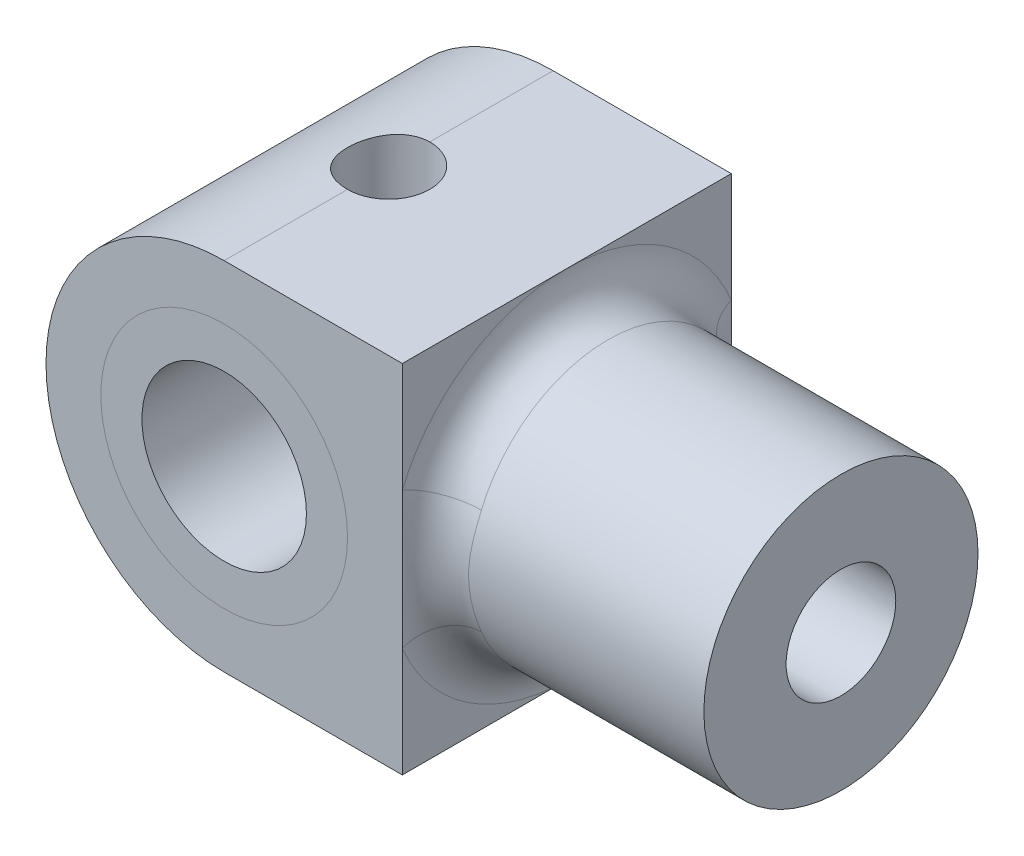
from build123d import *

# Parameters (mm, degrees)
SKETCH1_R           = 4.5
BOSS_EXTRUDE1_DEPTH = 6
SKETCH2_R           = 5
SKETCH2_R_2         = 2
BOSS_EXTRUDE2_DEPTH = 10
FILLET1_R           = 1.5
SKETCH1_3_R         = 4.5
SKETCH1_3_R_2       = 3
BOSS_EXTRUDE3_DEPTH = 6
SKETCH3_R           = 1.5
CUT_EXTRUDE1_DEPTH  = 19.721645382


with BuildPart() as part:
    # Sketch1 → Boss-Extrude1 (new, symmetric)
    with BuildSketch(Plane.XY):
        with BuildLine():
            ThreePointArc((0, -6.5), (-6.5, 0), (0, 6.5))
            Line((0, 6.5), (6.5, 6.5))
            Line((6.5, 6.5), (6.5, -6.5))
            Line((6.5, -6.5), (0, -6.5))
        make_face()
        Circle(SKETCH1_R, mode=Mode.SUBTRACT)
    extrude(amount=BOSS_EXTRUDE1_DEPTH, both=True)

    # Sketch2 → Boss-Extrude2 (add)
    with BuildSketch(Plane(origin=(6.5, 0, 0), x_dir=(0, 0, -1), z_dir=(1, 0, 0))):
        Circle(SKETCH2_R)
        Circle(SKETCH2_R_2, mode=Mode.SUBTRACT)
    extrude(amount=BOSS_EXTRUDE2_DEPTH)

    # Fillet1
    fillet1_edges = [part.edges().sort_by_distance(p)[0] for p in [
        (6.5, 0, 5),
    ]]
    fillet(fillet1_edges, radius=FILLET1_R - 0.0001)  # a hair under: the kernel refuses the full size


with BuildPart() as body_2:
    # Sketch1<3> → Boss-Extrude3 (new, symmetric)
    with BuildSketch(Plane.XY):
        Circle(SKETCH1_3_R)
        Circle(SKETCH1_3_R_2, mode=Mode.SUBTRACT)
    extrude(amount=BOSS_EXTRUDE3_DEPTH, both=True)


with BuildPart() as cut_extrude1_tool:
    # Sketch3 → Cut-Extrude1 (new, through all)
    with BuildSketch(Plane(origin=(0, 0, 0), x_dir=(1, 0, 0), z_dir=(0, 1, 0))):
        with Locations(Location((0, 0, 0), (0, 0, 90))):
            Circle(SKETCH3_R)
    extrude(amount=CUT_EXTRUDE1_DEPTH)


with BuildPart() as part_1:
    add(part.part)

    # Cut-Extrude1: cut by cut_extrude1_tool
    add(cut_extrude1_tool.part, mode=Mode.SUBTRACT)


with BuildPart() as body_2_1:
    add(body_2.part)

    # Cut-Extrude1: cut by cut_extrude1_tool
    add(cut_extrude1_tool.part, mode=Mode.SUBTRACT)


solid = Compound([part_1.part, body_2_1.part])
